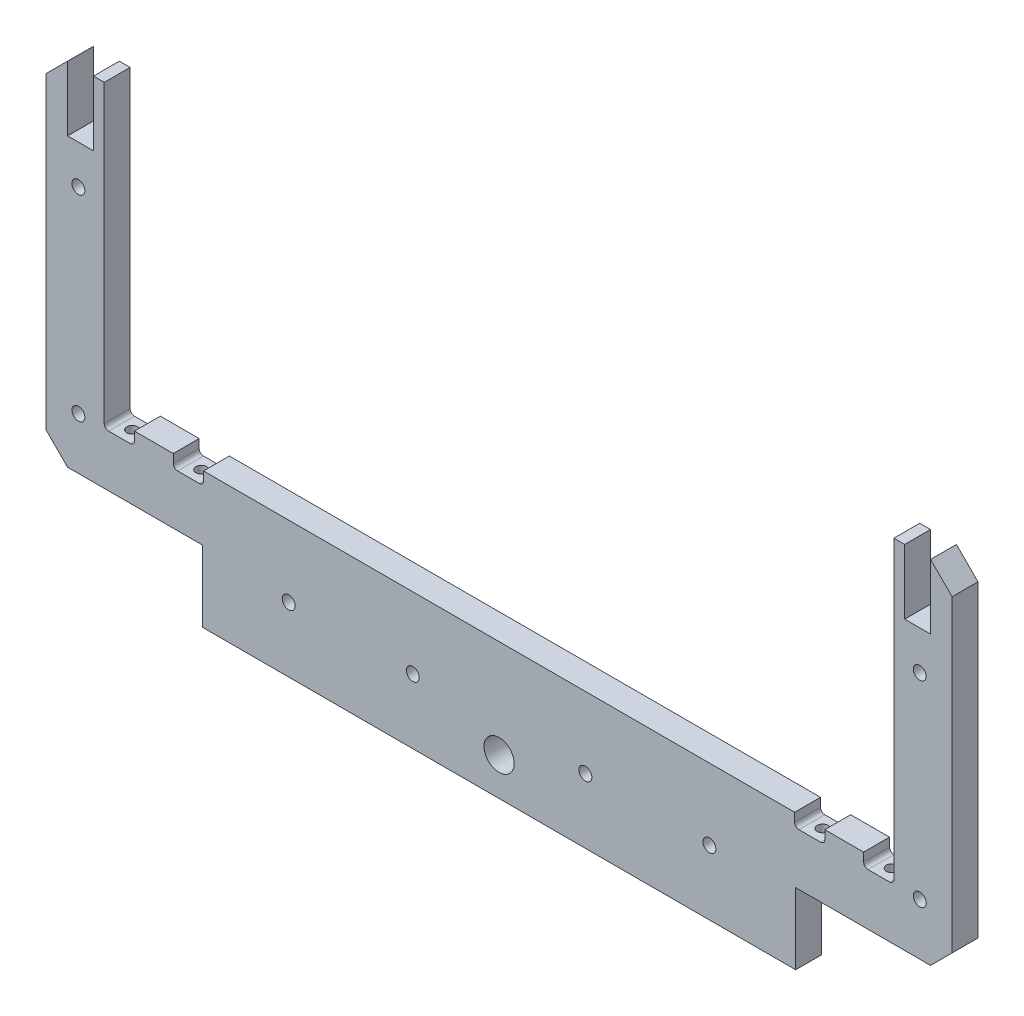
from build123d import *

# Parameters (mm, degrees)
SKETCH1_W                    = 275
SKETCH1_H                    = 33
BOSS_EXTRUDE1_DEPTH          = 12
CUT_EXTRUDE1_REACH           = 141.005
SKETCH2_R                    = 7
BOSS_EXTRUDE2_DEPTH          = 12
CUT_EXTRUDE2_REACH           = 250.863
SKETCH4_R                    = 2.5
CUT_EXTRUDE3_REACH           = 278.522
SKETCH5_W                    = 14
SKETCH5_H                    = 6
FILLET1_R                    = 2
FILLET1_OF_MIRROR2_R         = 2
CHAMFER1_SIZE                = 10
CUT_EXTRUDE4_REACH           = 278.522
SKETCH6_W                    = 12
SKETCH6_H                    = 30
CHAMFER2_SIZE                = 10
F_6_0_6_DIAMETER_HOLE1_D     = 6
F_6_0_6_DIAMETER_HOLE2_D     = 6
F_6_0_6_DIAMETER_HOLE2_DEPTH = 12
F_6_0_6_DIAMETER_HOLE2_TIP   = 1.802581857


with BuildPart() as part:
    # Sketch1 → Boss-Extrude1 (new body)
    with BuildSketch(Plane.XY):
        Rectangle(SKETCH1_W, SKETCH1_H)
    extrude(amount=BOSS_EXTRUDE1_DEPTH)

    # Sketch2 → Cut-Extrude1 (cut, up to next)
    with BuildSketch(Plane.XY.offset(12), mode=Mode.PRIVATE) as cut_extrude1_sk1:
        with Locations((0, 1)):
            Circle(SKETCH2_R)
    cut_extrude1_tool1 = extrude(cut_extrude1_sk1.sketch, amount=-CUT_EXTRUDE1_REACH, mode=Mode.PRIVATE) & part.part
    add(cut_extrude1_tool1.solids().sort_by_distance((0, 1, 12))[0], mode=Mode.SUBTRACT)

    # Sketch3 → Boss-Extrude2 (add)
    with BuildSketch(Plane.XY.offset(12)):
        Polygon((-210, 16.5), (210, 16.5), (210, 179.5), (183, 179.5), (183, 46.5), (-183, 46.5), (-183, 179.5), (-210, 179.5), align=None)
    extrude(amount=-BOSS_EXTRUDE2_DEPTH)

    # Sketch4 → Cut-Extrude2 (cut, up to next)
    with BuildSketch(Plane(origin=(0, 46.5, 0), x_dir=(1, 0, 0), z_dir=(0, 1, 0)), mode=Mode.PRIVATE) as cut_extrude2_sk1:
        with Locations(Location((-144, -6, 0), (0, 0, 270))):
            Circle(SKETCH4_R)
    cut_extrude2_tool1 = extrude(cut_extrude2_sk1.sketch, amount=-CUT_EXTRUDE2_REACH, mode=Mode.PRIVATE) & part.part
    # Sketch4 → Cut-Extrude2 (cut, up to next)
    with BuildSketch(Plane(origin=(0, 46.5, 0), x_dir=(1, 0, 0), z_dir=(0, 1, 0)), mode=Mode.PRIVATE) as cut_extrude2_sk2:
        with Locations(Location((-176, -6, 0), (0, 0, 270))):
            Circle(SKETCH4_R)
    cut_extrude2_tool2 = extrude(cut_extrude2_sk2.sketch, amount=-CUT_EXTRUDE2_REACH, mode=Mode.PRIVATE) & part.part
    cut_extrude2_1 = cut_extrude2_tool1.solids().sort_by_distance((-144, 46.5, 6))[0]
    add(cut_extrude2_1, mode=Mode.SUBTRACT)
    cut_extrude2_2 = cut_extrude2_tool2.solids().sort_by_distance((-176, 46.5, 6))[0]
    add(cut_extrude2_2, mode=Mode.SUBTRACT)
    cut_extrude2 = cut_extrude2_1 + cut_extrude2_2  # Cut-Extrude2 as one shape, for the pattern or mirror that repeats it

    # Mirror1: Cut-Extrude2 across plane
    add(cut_extrude2.mirror(Plane(origin=(0, 0, 0), x_dir=(0, 0, 1), z_dir=(1, 0, 0))), mode=Mode.SUBTRACT)

    # Sketch5 → Cut-Extrude3 (cut, up to next)
    with BuildSketch(Plane.XY.offset(12), mode=Mode.PRIVATE) as cut_extrude3_sk1:
        with Locations((-176, 43.5)):
            Rectangle(SKETCH5_W, SKETCH5_H)
    cut_extrude3_tool1 = extrude(cut_extrude3_sk1.sketch, amount=-CUT_EXTRUDE3_REACH, mode=Mode.PRIVATE) & part.part
    # Sketch5 → Cut-Extrude3 (cut, up to next)
    with BuildSketch(Plane.XY.offset(12), mode=Mode.PRIVATE) as cut_extrude3_sk2:
        with Locations((-144, 43.5)):
            Rectangle(SKETCH5_W, SKETCH5_H)
    cut_extrude3_tool2 = extrude(cut_extrude3_sk2.sketch, amount=-CUT_EXTRUDE3_REACH, mode=Mode.PRIVATE) & part.part
    cut_extrude3_1 = cut_extrude3_tool1.solids().sort_by_distance((-176, 43.5, 12))[0]
    add(cut_extrude3_1, mode=Mode.SUBTRACT)
    cut_extrude3_2 = cut_extrude3_tool2.solids().sort_by_distance((-144, 43.5, 12))[0]
    add(cut_extrude3_2, mode=Mode.SUBTRACT)
    cut_extrude3 = cut_extrude3_1 + cut_extrude3_2  # Cut-Extrude3 as one shape, for the pattern or mirror that repeats it

    # Fillet1
    fillet1_edges = [part.edges().sort_by_distance(p)[0] for p in [
        (-169, 40.5, 6),
        (-183, 40.5, 6),
        (-137, 40.5, 6),
        (-151, 40.5, 6),
    ]]
    fillet(fillet1_edges, radius=FILLET1_R)

    # Mirror2: Cut-Extrude3 across plane
    add(cut_extrude3.mirror(Plane(origin=(0, 0, 0), x_dir=(0, 0, 1), z_dir=(1, 0, 0))), mode=Mode.SUBTRACT)

    # Fillet1 of Mirror2
    fillet1_of_mirror2_edges = [part.edges().sort_by_distance(p)[0] for p in [
        (169, 40.5, 6),
        (183, 40.5, 6),
        (137, 40.5, 6),
        (151, 40.5, 6),
    ]]
    fillet(fillet1_of_mirror2_edges, radius=FILLET1_OF_MIRROR2_R)

    # Chamfer1
    chamfer1_edges = [part.edges().sort_by_distance(p)[0] for p in [
        (210, 16.5, 6),
        (-210, 16.5, 6),
    ]]
    chamfer(chamfer1_edges, length=CHAMFER1_SIZE)

    # Sketch6 → Cut-Extrude4 (cut, up to next)
    with BuildSketch(Plane.XY.offset(12), mode=Mode.PRIVATE) as cut_extrude4_sk1:
        with Locations((-194, 164.5)):
            Rectangle(SKETCH6_W, SKETCH6_H)
    cut_extrude4_tool1 = extrude(cut_extrude4_sk1.sketch, amount=-CUT_EXTRUDE4_REACH, mode=Mode.PRIVATE) & part.part
    cut_extrude4 = cut_extrude4_tool1.solids().sort_by_distance((-194, 164.5, 12))[0]
    add(cut_extrude4, mode=Mode.SUBTRACT)

    # Mirror3: Cut-Extrude4 across plane
    add(cut_extrude4.mirror(Plane(origin=(0, 0, 0), x_dir=(0, 0, 1), z_dir=(1, 0, 0))), mode=Mode.SUBTRACT)

    # Chamfer2
    chamfer2_edges = [part.edges().sort_by_distance(p)[0] for p in [
        (210, 179.5, 6),
        (-210, 179.5, 6),
    ]]
    chamfer(chamfer2_edges, length=CHAMFER2_SIZE - 0.0001)  # a hair under: the kernel refuses the full size

    # Ø6.0 (6) Diameter Hole1 (through all)
    with Locations(Plane.XY.offset(12)):
        with Locations((-195, 40.5), (-195, 131.5)):
            f_6_0_6_diameter_hole1 = Hole(F_6_0_6_DIAMETER_HOLE1_D / 2)

    # Mirror4: Ø6.0 (6) Diameter Hole1 across plane
    add(f_6_0_6_diameter_hole1.mirror(Plane(origin=(0, 0, 0), x_dir=(0, 0, 1), z_dir=(1, 0, 0))), mode=Mode.SUBTRACT)

    # Ø6.0 (6) Diameter Hole2
    with Locations(Plane.XY.offset(12)):
        with Locations((-97.5, 13.5), (-40, 13.5), (40, 13.5), (97.5, 13.5)):
            Hole(F_6_0_6_DIAMETER_HOLE2_D / 2, depth=F_6_0_6_DIAMETER_HOLE2_DEPTH)
            with Locations((0, 0, -(F_6_0_6_DIAMETER_HOLE2_DEPTH + F_6_0_6_DIAMETER_HOLE2_TIP / 2))):  # 118° drill point
                Cone(0, F_6_0_6_DIAMETER_HOLE2_D / 2, F_6_0_6_DIAMETER_HOLE2_TIP, mode=Mode.SUBTRACT)


solid = part.part
